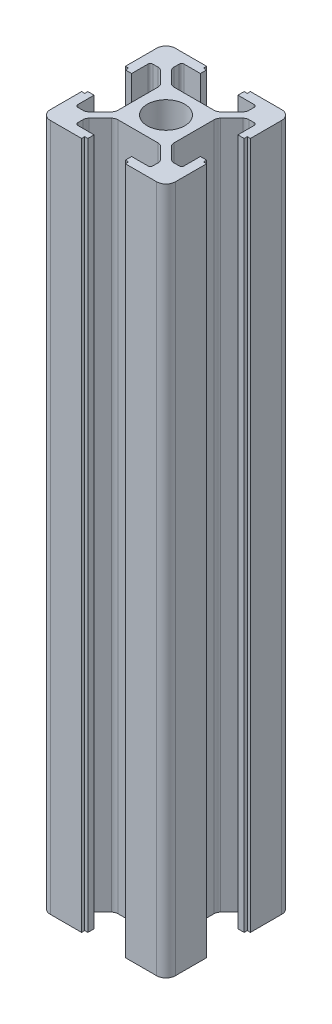
from build123d import *

# Parameters (mm, degrees)
BOSS_EXTRU_1_CORPS_DEPTH    = 110
CONG_1_R                    = 1.5
CONG_2_R                    = 0.4
CONG_4_R                    = 1
CONG_1_OF_SYM_TRIE_BRAS_R   = 1.5
CONG_2_OF_SYM_TRIE_BRAS_R   = 0.4
CONG_4_OF_SYM_TRIE_BRAS_R   = 1
SYM_TRIE_BRAS_DOUBLE_DEPTH  = 110
APR_S_TARODAGE_M6_R         = 3
ENL_V_MAT_FILETAGE_M6_DEPTH = 111.905365064


# Read off the part's stored shape, not the designer's step: Symétrie Bras double
with BuildPart() as part:
    # Esquisse4 → Boss.-Extru.1 Corps (new body)
    with BuildSketch(Plane(origin=(0, 0, 0), x_dir=(1, 0, 0), z_dir=(0, 1, 0))):
        Polygon((0, 0), (-4.5, 0), (-4.5, 3.625), (-6.875, 6), (-8.5, 6), (-8.5, 3), (-9.5, 3), (-9.5, 3.5), (-10, 3.5), (-10, 10), (-3.5, 10), (-3.5, 9.5), (-3, 9.5), (-3, 8.5), (-6, 8.5), (-6, 6.875), (-3.625, 4.5), (0, 4.5), align=None)
    boss_extru_1_corps = extrude(amount=BOSS_EXTRU_1_CORPS_DEPTH)

    # Congé1
    cong_1_edges = [part.edges().sort_by_distance(p)[0] for p in [
        (-10, 55, -10),
    ]]
    fillet(cong_1_edges, radius=CONG_1_R)

    # Congé2
    cong_2_edges = [part.edges().sort_by_distance(p)[0] for p in [
        (-8.5, 55, -6),
        (-6, 55, -8.5),
    ]]
    fillet(cong_2_edges, radius=CONG_2_R)

    # Congé4
    cong_4_edges = [part.edges().sort_by_distance(p)[0] for p in [
        (-4.5, 55, -3.625),
        (-6.875, 55, -6),
        (-6, 55, -6.875),
        (-3.625, 55, -4.5),
    ]]
    fillet(cong_4_edges, radius=CONG_4_R)

    # Symétrie Bras: Boss.-Extru.1 Corps across plane
    add(boss_extru_1_corps.mirror(Plane(origin=(0, 110, -4.5), x_dir=(0, 0, 1), z_dir=(-1, 0, 0))))

    # Congé1 of Symétrie Bras
    cong_1_of_sym_trie_bras_edges = [part.edges().sort_by_distance(p)[0] for p in [
        (10, 55, -10),
    ]]
    fillet(cong_1_of_sym_trie_bras_edges, radius=CONG_1_OF_SYM_TRIE_BRAS_R)

    # Congé2 of Symétrie Bras
    cong_2_of_sym_trie_bras_edges = [part.edges().sort_by_distance(p)[0] for p in [
        (8.5, 55, -6),
        (6, 55, -8.5),
    ]]
    fillet(cong_2_of_sym_trie_bras_edges, radius=CONG_2_OF_SYM_TRIE_BRAS_R)

    # Congé4 of Symétrie Bras
    cong_4_of_sym_trie_bras_edges = [part.edges().sort_by_distance(p)[0] for p in [
        (4.5, 55, -3.625),
        (6.875, 55, -6),
        (6, 55, -6.875),
        (3.625, 55, -4.5),
    ]]
    fillet(cong_4_of_sym_trie_bras_edges, radius=CONG_4_OF_SYM_TRIE_BRAS_R)

    # Symétrie Bras double outline → Symétrie Bras double (add)
    with BuildSketch(Plane(origin=(0, 0, 0), x_dir=(1, 0, 0), z_dir=(0, 1, 0))):
        with BuildLine():
            ThreePointArc((7.289213562, -6), (6.90653013, -5.923879533), (6.582106781, -5.707106781))
            Line((6.582106781, -5.707106781), (4.792893219, -3.917893219))
            ThreePointArc((4.792893219, -3.917893219), (4.576120467, -3.59346987), (4.5, -3.210786438))
            Line((4.5, -3.210786438), (4.5, 0))
            Line((4.5, 0), (-4.5, 0))
            Line((-4.5, 0), (-4.5, -3.210786438))
            ThreePointArc((-4.5, -3.210786438), (-4.576120467, -3.59346987), (-4.792893219, -3.917893219))
            Line((-4.792893219, -3.917893219), (-6.582106781, -5.707106781))
            ThreePointArc((-6.582106781, -5.707106781), (-6.90653013, -5.923879533), (-7.289213562, -6))
            Line((-7.289213562, -6), (-8.1, -6))
            ThreePointArc((-8.1, -6), (-8.382842712, -5.882842712), (-8.5, -5.6))
            Line((-8.5, -5.6), (-8.5, -3))
            Line((-8.5, -3), (-9.5, -3))
            Line((-9.5, -3), (-9.5, -3.5))
            Line((-9.5, -3.5), (-10, -3.5))
            Line((-10, -3.5), (-10, -8.5))
            ThreePointArc((-10, -8.5), (-9.560660172, -9.560660172), (-8.5, -10))
            Line((-8.5, -10), (-3.5, -10))
            Line((-3.5, -10), (-3.5, -9.5))
            Line((-3.5, -9.5), (-3, -9.5))
            Line((-3, -9.5), (-3, -8.5))
            Line((-3, -8.5), (-5.6, -8.5))
            ThreePointArc((-5.6, -8.5), (-5.882842712, -8.382842712), (-6, -8.1))
            Line((-6, -8.1), (-6, -7.289213562))
            ThreePointArc((-6, -7.289213562), (-5.923879533, -6.90653013), (-5.707106781, -6.582106781))
            Line((-5.707106781, -6.582106781), (-3.917893219, -4.792893219))
            ThreePointArc((-3.917893219, -4.792893219), (-3.59346987, -4.576120467), (-3.210786438, -4.5))
            Line((-3.210786438, -4.5), (3.210786438, -4.5))
            ThreePointArc((3.210786438, -4.5), (3.59346987, -4.576120467), (3.917893219, -4.792893219))
            Line((3.917893219, -4.792893219), (5.707106781, -6.582106781))
            ThreePointArc((5.707106781, -6.582106781), (5.923879533, -6.90653013), (6, -7.289213562))
            Line((6, -7.289213562), (6, -8.1))
            ThreePointArc((6, -8.1), (5.882842712, -8.382842712), (5.6, -8.5))
            Line((5.6, -8.5), (3, -8.5))
            Line((3, -8.5), (3, -9.5))
            Line((3, -9.5), (3.5, -9.5))
            Line((3.5, -9.5), (3.5, -10))
            Line((3.5, -10), (8.5, -10))
            ThreePointArc((8.5, -10), (9.560660172, -9.560660172), (10, -8.5))
            Line((10, -8.5), (10, -3.5))
            Line((10, -3.5), (9.5, -3.5))
            Line((9.5, -3.5), (9.5, -3))
            Line((9.5, -3), (8.5, -3))
            Line((8.5, -3), (8.5, -5.6))
            ThreePointArc((8.5, -5.6), (8.382842712, -5.882842712), (8.1, -6))
            Line((8.1, -6), (7.289213562, -6))
        make_face()
    extrude(amount=SYM_TRIE_BRAS_DOUBLE_DEPTH)

    # Après tarodage M6 → Enlèv. mat.-Filetage M6 (cut, through all)
    with BuildSketch(Plane.XZ):
        with Locations(Location((0, 0, 0), (0, 0, 270))):
            Circle(APR_S_TARODAGE_M6_R)
    extrude(amount=-ENL_V_MAT_FILETAGE_M6_DEPTH, mode=Mode.SUBTRACT)


solid = part.part
